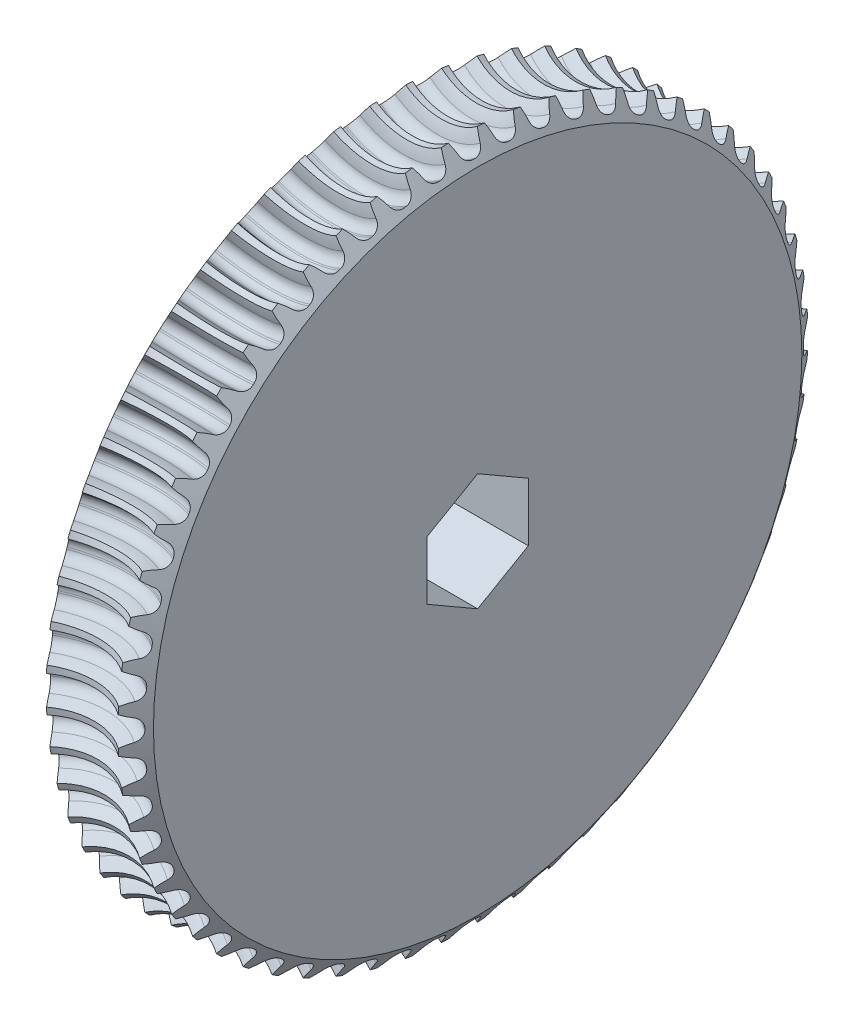
from build123d import *

# Parameters (mm, degrees)
RACCORDO2_R                          = 0.5
RIPETIZIONECIRCOLARE1_COUNT          = 60
RACCORDO2_OF_RIPETIZIONECIRCOLARE1_R = 0.5
TAGLIO_ESTRUSIONE1_DEPTH             = 25.182952054
TAGLIO_ESTRUSIONE1_DEPTH_BACK        = 25.182952054


with BuildPart() as part:
    # Schizzo1 → Rivoluzione1 (revolve)
    with BuildSketch(Plane.XY, mode=Mode.PRIVATE) as rivoluzione1_sk:
        with BuildLine():
            Line((-2.5, 0), (2.5, 0))
            Line((2.5, 0), (2.5, 16))
            Line((2.5, 16), (1.769987478, 17.022017531))
            ThreePointArc((1.769987478, 17.022017531), (0.000278112, 16.445327267), (-1.768963423, 17.023451208))
            Line((-1.768963423, 17.023451208), (-2.5, 16))
            Line((-2.5, 16), (-2.5, 0))
        make_face()
    revolve(rivoluzione1_sk.sketch.rotate(Axis((-2.5, 0, 0), (1, 0, 0)), 90), axis=Axis((-2.5, 0, 0), (1, 0, 0)))

    # Schizzo2 → Taglia-Rivoluzione1 (revolve, cut)
    with BuildSketch(Plane(origin=(0, 0, 0), x_dir=(0, 0, -1), z_dir=(1, 0, 0))):
        with BuildLine():
            Line((1.530737533, 17.648913895), (-1.530737533, 17.648913895))
            ThreePointArc((-1.530737533, 17.648913895), (-0.820914571, 16.655620212), (-0.446604889, 15.493564602))
            Line((-0.446604889, 15.493564602), (0.446604889, 15.493564602))
            ThreePointArc((0.446604889, 15.493564602), (0.820914571, 16.655620212), (1.530737533, 17.648913895))
        make_face()
    taglia_rivoluzione1 = revolve(axis=Axis((0, 19.445327021, 0), (0, 0, -1)), mode=Mode.SUBTRACT)

    # Raccordo2
    raccordo2_edges = [part.edges().sort_by_distance(p)[0] for p in [
        (0, 15.493564602, -0.446604889),
        (0, 15.493564602, 0.446604889),
    ]]
    fillet(raccordo2_edges, radius=RACCORDO2_R)

    # RipetizioneCircolare1: Taglia-Rivoluzione1 ×60 about axis
    ripetizionecircolare1_axis = Axis((1.769987478, 0, 0), (-1, 0, 0))
    for i in range(1, RIPETIZIONECIRCOLARE1_COUNT):
        add(taglia_rivoluzione1.rotate(ripetizionecircolare1_axis, i * 360 / RIPETIZIONECIRCOLARE1_COUNT), mode=Mode.SUBTRACT)

    # Raccordo2 of RipetizioneCircolare1
    raccordo2_of_ripetizionecircolare1_edges = [part.edges().sort_by_distance(p)[0] for p in [
        (0, 15.362006311, -2.063676839),
        (0, 15.455372157, -1.175360158),
        (0, 15.062138665, -3.658138714),
        (0, 15.24784742, -2.784447713),
        (0, 14.597247075, -5.212521255),
        (0, 14.873264076, -4.363028276),
        (0, 13.972424992, -6.709794323),
        (0, 14.335726138, -5.893806588),
        (0, 13.194518096, -8.13355348),
        (0, 13.641122985, -7.360011122),
        (0, 12.272049299, -9.468199723),
        (0, 12.797064834, -8.745577834),
        (0, 11.215125362, -10.699110389),
        (0, 11.812799362, -10.035326165),
        (0, 10.035326165, -11.812799362),
        (0, 10.699110389, -11.215125362),
        (0, 8.745577834, -12.797064834),
        (0, 9.468199723, -12.272049299),
        (0, 7.360011122, -13.641122985),
        (0, 8.13355348, -13.194518096),
        (0, 5.893806588, -14.335726138),
        (0, 6.709794323, -13.972424992),
        (0, 4.363028276, -14.873264076),
        (0, 5.212521255, -14.597247075),
        (0, 2.784447713, -15.24784742),
        (0, 3.658138714, -15.062138665),
        (0, 1.175360158, -15.455372157),
        (0, 2.063676839, -15.362006311),
        (0, -0.446604889, -15.493564602),
        (0, 0.446604889, -15.493564602),
        (0, -2.063676839, -15.362006311),
        (0, -1.175360158, -15.455372157),
        (0, -3.658138714, -15.062138665),
        (0, -2.784447713, -15.24784742),
        (0, -5.212521255, -14.597247075),
        (0, -4.363028276, -14.873264076),
        (0, -6.709794323, -13.972424992),
        (0, -5.893806588, -14.335726138),
        (0, -8.13355348, -13.194518096),
        (0, -7.360011122, -13.641122985),
        (0, -9.468199723, -12.272049299),
        (0, -8.745577834, -12.797064834),
        (0, -10.699110389, -11.215125362),
        (0, -10.035326165, -11.812799362),
        (0, -11.812799362, -10.035326165),
        (0, -11.215125362, -10.699110389),
        (0, -12.797064834, -8.745577834),
        (0, -12.272049299, -9.468199723),
        (0, -13.641122985, -7.360011122),
        (0, -13.194518096, -8.13355348),
        (0, -14.335726138, -5.893806588),
        (0, -13.972424992, -6.709794323),
        (0, -14.873264076, -4.363028276),
        (0, -14.597247075, -5.212521255),
        (0, -15.24784742, -2.784447713),
        (0, -15.062138665, -3.658138714),
        (0, -15.455372157, -1.175360158),
        (0, -15.362006311, -2.063676839),
        (0, -15.493564602, 0.446604889),
        (0, -15.493564602, -0.446604889),
        (0, -15.362006311, 2.063676839),
        (0, -15.455372157, 1.175360158),
        (0, -15.062138665, 3.658138714),
        (0, -15.24784742, 2.784447713),
        (0, -14.597247075, 5.212521255),
        (0, -14.873264076, 4.363028276),
        (0, -13.972424992, 6.709794323),
        (0, -14.335726138, 5.893806588),
        (0, -13.194518096, 8.13355348),
        (0, -13.641122985, 7.360011122),
        (0, -12.272049299, 9.468199723),
        (0, -12.797064834, 8.745577834),
        (0, -11.215125362, 10.699110389),
        (0, -11.812799362, 10.035326165),
        (0, -10.035326165, 11.812799362),
        (0, -10.699110389, 11.215125362),
        (0, -8.745577834, 12.797064834),
        (0, -9.468199723, 12.272049299),
        (0, -7.360011122, 13.641122985),
        (0, -8.13355348, 13.194518096),
        (0, -5.893806588, 14.335726138),
        (0, -6.709794323, 13.972424992),
        (0, -4.363028276, 14.873264076),
        (0, -5.212521255, 14.597247075),
        (0, -2.784447713, 15.24784742),
        (0, -3.658138714, 15.062138665),
        (0, -1.175360158, 15.455372157),
        (0, -2.063676839, 15.362006311),
        (0, 0.446604889, 15.493564602),
        (0, -0.446604889, 15.493564602),
        (0, 2.063676839, 15.362006311),
        (0, 1.175360158, 15.455372157),
        (0, 3.658138714, 15.062138665),
        (0, 2.784447713, 15.24784742),
        (0, 5.212521255, 14.597247075),
        (0, 4.363028276, 14.873264076),
        (0, 6.709794323, 13.972424992),
        (0, 5.893806588, 14.335726138),
        (0, 8.13355348, 13.194518096),
        (0, 7.360011122, 13.641122985),
        (0, 9.468199723, 12.272049299),
        (0, 8.745577834, 12.797064834),
        (0, 10.699110389, 11.215125362),
        (0, 10.035326165, 11.812799362),
        (0, 11.812799362, 10.035326165),
        (0, 11.215125362, 10.699110389),
        (0, 12.797064834, 8.745577834),
        (0, 12.272049299, 9.468199723),
        (0, 13.641122985, 7.360011122),
        (0, 13.194518096, 8.13355348),
        (0, 14.335726138, 5.893806588),
        (0, 13.972424992, 6.709794323),
        (0, 14.873264076, 4.363028276),
        (0, 14.597247075, 5.212521255),
        (0, 15.24784742, 2.784447713),
        (0, 15.062138665, 3.658138714),
        (0, 15.455372157, 1.175360158),
        (0, 15.362006311, 2.063676839),
    ]]
    fillet(raccordo2_of_ripetizionecircolare1_edges, radius=RACCORDO2_OF_RIPETIZIONECIRCOLARE1_R)

    # Schizzo3 → Taglio-Estrusione1 (cut, two sides: drawn at the far end of the back side and taken through both)
    with BuildSketch(Plane(origin=(0, 0, 0), x_dir=(0, 0, -1), z_dir=(1, 0, 0)).offset(-TAGLIO_ESTRUSIONE1_DEPTH_BACK)):
        Polygon((0, 2.886751346), (-2.5, 1.443375673), (-2.5, -1.443375673), (0, -2.886751346), (2.5, -1.443375673), (2.5, 1.443375673), align=None)
    extrude(amount=TAGLIO_ESTRUSIONE1_DEPTH + TAGLIO_ESTRUSIONE1_DEPTH_BACK, mode=Mode.SUBTRACT)


solid = part.part
